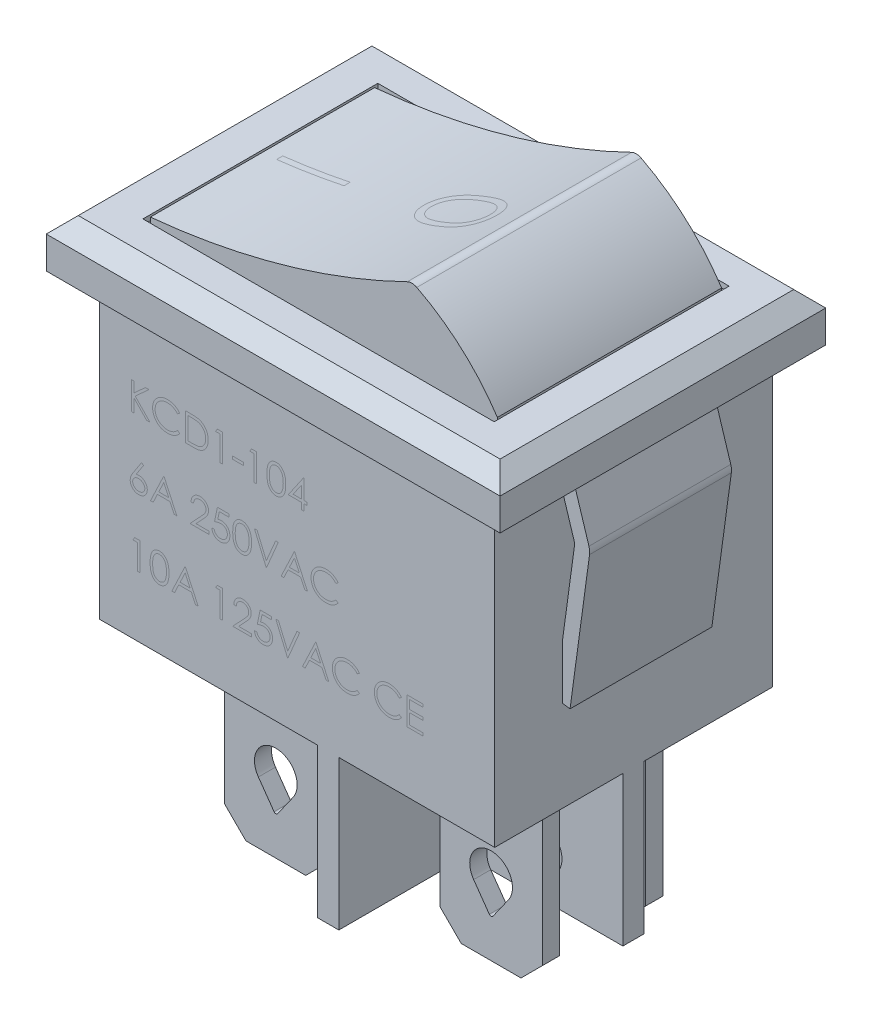
from build123d import *

# Parameters (mm, degrees)
SKETCH1_W               = 18.5
SKETCH1_H               = 14
BOSS_EXTRUDE1_DEPTH     = 6.5
SKETCH2_W               = 21.25
SKETCH2_H               = 15.25
BOSS_EXTRUDE2_DEPTH     = 2.25
CHAMFER1_SIZE           = 0.75
SKETCH11_W              = 16.45
SKETCH11_H              = 11
CUT_EXTRUDE6_DEPTH      = 0.25
BOSS_EXTRUDE3_DEPTH     = 5.25
BOSS_EXTRUDE4_DEPTH     = 7
SKETCH5_W               = 4.8
SKETCH5_H               = 0.8
BOSS_EXTRUDE5_DEPTH     = 8.36
CHAMFER2_SIZE           = 1
CUT_EXTRUDE1_DEPTH      = 22.39902451
CUT_EXTRUDE1_DEPTH_BACK = 22.39902451
EXTRUDE_THIN14_DEPTH    = 3.32
EXTRUDE_THIN14_2_DEPTH  = 3.32
SKETCH10_W              = 18.5
SKETCH10_H              = 14
CUT_EXTRUDE5_DEPTH      = 22.647476758


with BuildPart() as part:
    # Sketch1 → Boss-Extrude1 (new, symmetric)
    with BuildSketch(Plane.XY):
        Rectangle(SKETCH1_W, SKETCH1_H)
    extrude(amount=BOSS_EXTRUDE1_DEPTH, both=True)

    # Sketch2 → Boss-Extrude2 (add)
    with BuildSketch(Plane(origin=(0, 7, 0), x_dir=(1, 0, 0), z_dir=(0, 1, 0))):
        Rectangle(SKETCH2_W, SKETCH2_H)
    extrude(amount=BOSS_EXTRUDE2_DEPTH)

    # Chamfer1
    chamfer1_edges = [part.edges().sort_by_distance(p)[0] for p in [
        (0, 9.25, -7.625),
        (10.625, 9.25, 0),
        (0, 9.25, 7.625),
        (-10.625, 9.25, 0),
    ]]
    chamfer(chamfer1_edges, length=CHAMFER1_SIZE)

    # Sketch11 → Cut-Extrude6 (cut)
    with BuildSketch(Plane(origin=(0, 9.25, 0), x_dir=(1, 0, 0), z_dir=(0, 1, 0))):
        Rectangle(SKETCH11_W, SKETCH11_H)
    extrude(amount=-CUT_EXTRUDE6_DEPTH, mode=Mode.SUBTRACT)

    # Sketch3 → Boss-Extrude3 (add, symmetric)
    with BuildSketch(Plane.XY):
        with BuildLine():
            Line((-8.125, 9.25), (-8.125, 8.95))
            Line((-8.125, 8.95), (8.125, 8.95))
            Line((8.125, 8.95), (8.125, 9.25))
            ThreePointArc((8.125, 9.25), (6.456919845, 11.18630876), (4.352505214, 12.63655773))
            ThreePointArc((4.352505214, 12.63655773), (4.128960666, 12.691944964), (3.904303675, 12.641258211))
            ThreePointArc((3.904303675, 12.641258211), (-1.957748604, 10.404335486), (-8.125, 9.25))
        make_face()
    extrude(amount=BOSS_EXTRUDE3_DEPTH, both=True)

    # Sketch4 → Boss-Extrude4 (add)
    with BuildSketch(Plane(origin=(0, -7, 0), x_dir=(-1, 0, 0), z_dir=(0, -1, 0))):
        Polygon((-0.95, 6.5), (-1.95, 6.5), (-1.95, 0.5), (-9.25, 0.5), (-9.25, -0.5), (-1.95, -0.5), (-1.95, -6.5), (-0.95, -6.5), (-0.95, -0.5), (9.25, -0.5), (9.25, 0.5), (-0.95, 0.5), align=None)
    extrude(amount=BOSS_EXTRUDE4_DEPTH)

    # Sketch5 → Boss-Extrude5 (add)
    with BuildSketch(Plane.XZ.offset(7)):
        with Locations((5.4, 2.42)):
            Rectangle(SKETCH5_W, SKETCH5_H)
        with Locations((-3.8, -3.3)):
            Rectangle(SKETCH5_W, SKETCH5_H)
        with Locations((5.4, -2.42)):
            Rectangle(SKETCH5_W, SKETCH5_H)
        with Locations((-3.8, 3.3)):
            Rectangle(SKETCH5_W, SKETCH5_H)
    extrude(amount=BOSS_EXTRUDE5_DEPTH)

    # Chamfer2
    chamfer2_edges = [part.edges().sort_by_distance(p)[0] for p in [
        (7.8, -15.36, 2.42),
        (3, -15.36, 2.42),
        (-1.4, -15.36, -3.3),
        (-6.2, -15.36, -3.3),
        (7.8, -15.36, -2.42),
        (3, -15.36, -2.42),
        (-1.4, -15.36, 3.3),
        (-6.2, -15.36, 3.3),
    ]]
    chamfer(chamfer2_edges, length=CHAMFER2_SIZE)

    # Sketch6 → Cut-Extrude1 (cut, two sides: drawn at the far end of the back side and taken through both)
    with BuildSketch(Plane.XY.offset(2.82).offset(-CUT_EXTRUDE1_DEPTH_BACK)):
        with BuildLine():
            Line((5.318320152, -13.517692308), (4.583201516, -12.476923077))
            ThreePointArc((4.583201516, -12.476923077), (5.4, -10.9), (6.216798484, -12.476923077))
            Line((6.216798484, -12.476923077), (5.481679848, -13.517692308))
            ThreePointArc((5.481679848, -13.517692308), (5.4, -13.56), (5.318320152, -13.517692308))
        make_face()
        with BuildLine():
            Line((-3.881679848, -13.517692308), (-4.616798484, -12.476923077))
            ThreePointArc((-4.616798484, -12.476923077), (-3.8, -10.9), (-2.983201516, -12.476923077))
            Line((-2.983201516, -12.476923077), (-3.718320152, -13.517692308))
            ThreePointArc((-3.718320152, -13.517692308), (-3.8, -13.56), (-3.881679848, -13.517692308))
        make_face()
    extrude(amount=CUT_EXTRUDE1_DEPTH + CUT_EXTRUDE1_DEPTH_BACK, mode=Mode.SUBTRACT)


with BuildPart() as body_2:
    # Sketch9 → Extrude-Thin14 (new, symmetric)
    with BuildSketch(Plane.XY):
        with BuildLine():
            Line((-9.583967117, 7.104718503), (-10.482264459, 4.23987833))
            ThreePointArc((-10.482264459, 4.23987833), (-10.5139557, 4.078650393), (-10.509776475, 3.914390487))
            Line((-10.509776475, 3.914390487), (-9.596806058, -2.797175824))
            Line((-9.596806058, -2.797175824), (-8.903193942, -2.702824176))
            Line((-8.903193942, -2.702824176), (-9.81616436, 4.008742135))
            ThreePointArc((-9.81616436, 4.008742135), (-9.816442975, 4.019692796), (-9.814330225, 4.030441325))
            Line((-9.814330225, 4.030441325), (-8.916032883, 6.895281497))
            Line((-8.916032883, 6.895281497), (-9.583967117, 7.104718503))
        make_face()
    extrude(amount=EXTRUDE_THIN14_DEPTH, both=True)


with BuildPart() as body_3:
    # Sketch9 → Extrude-Thin14 2 (new, symmetric)
    with BuildSketch(Plane.XY):
        with BuildLine():
            Line((8.916032883, 6.895281497), (9.814330225, 4.030441325))
            ThreePointArc((9.814330225, 4.030441325), (9.816442975, 4.019692796), (9.81616436, 4.008742135))
            Line((9.81616436, 4.008742135), (8.903193942, -2.702824176))
            Line((8.903193942, -2.702824176), (9.596806058, -2.797175824))
            Line((9.596806058, -2.797175824), (10.509776475, 3.914390487))
            ThreePointArc((10.509776475, 3.914390487), (10.5139557, 4.078650393), (10.482264459, 4.23987833))
            Line((10.482264459, 4.23987833), (9.583967117, 7.104718503))
            Line((9.583967117, 7.104718503), (8.916032883, 6.895281497))
        make_face()
    extrude(amount=EXTRUDE_THIN14_2_DEPTH, both=True)


with BuildPart() as cut_extrude5_tool:
    # Sketch10 → Cut-Extrude5 (new, through all)
    with BuildSketch(Plane.XY.offset(3.32)):
        Rectangle(SKETCH10_W, SKETCH10_H)
    extrude(amount=-CUT_EXTRUDE5_DEPTH)


with BuildPart() as body_2_1:
    add(body_2.part)

    # Cut-Extrude5: cut by cut_extrude5_tool
    add(cut_extrude5_tool.part, mode=Mode.SUBTRACT)


with BuildPart() as body_3_1:
    add(body_3.part)

    # Cut-Extrude5: cut by cut_extrude5_tool
    add(cut_extrude5_tool.part, mode=Mode.SUBTRACT)


solid = Compound([part.part, body_2_1.part, body_3_1.part])
